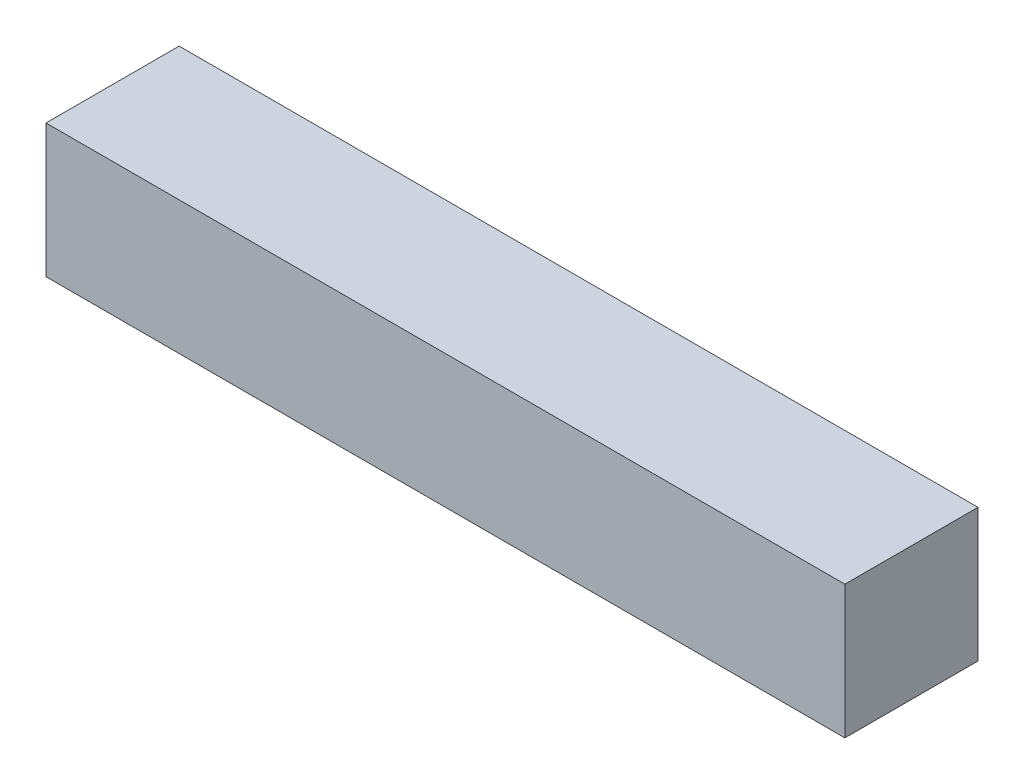
from build123d import *

# Parameters (mm, degrees)
SKETCH1_W           = 6.35
SKETCH1_H           = 6.35
BOSS_EXTRUDE1_DEPTH = 38.1


with BuildPart() as part:
    # Sketch1 → Boss-Extrude1 (new body)
    with BuildSketch(Plane(origin=(0, 0, 0), x_dir=(0, 0, -1), z_dir=(1, 0, 0))):
        Rectangle(SKETCH1_W, SKETCH1_H)
    extrude(amount=BOSS_EXTRUDE1_DEPTH)


solid = part.part
